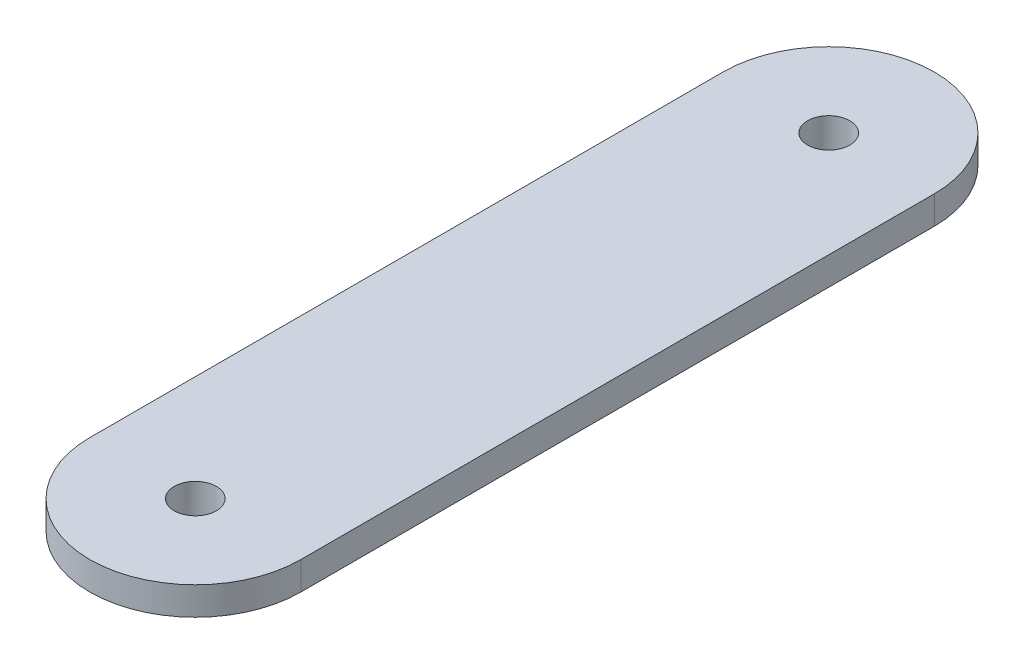
from build123d import *

# Parameters (mm, degrees)
BOSS_EXTRUDE1_DEPTH = 2
SKETCH2_R           = 1.5
CUT_EXTRUDE1_DEPTH  = 31.987900865
SKETCH3_R           = 2.25
SKETCH3_R_2         = 1.5
BOSS_EXTRUDE2_DEPTH = 0.5
FILLET1_R           = 5


with BuildPart() as part:
    # Sketch1 → Boss-Extrude1 (new body)
    with BuildSketch(Plane(origin=(0, 0, 0), x_dir=(1, 0, 0), z_dir=(0, 1, 0))):
        with BuildLine():
            Line((7.5, 22.5), (7.5, -22.5))
            ThreePointArc((7.5, -22.5), (0, -30), (-7.5, -22.5))
            Line((-7.5, -22.5), (-7.5, 22.5))
            ThreePointArc((-7.5, 22.5), (0, 30), (7.5, 22.5))
        make_face()
    extrude(amount=BOSS_EXTRUDE1_DEPTH)

    # Sketch2 → Cut-Extrude1 (cut, through all)
    with BuildSketch(Plane(origin=(0, 2, 0), x_dir=(1, 0, 0), z_dir=(0, 1, 0))):
        with Locations(Location((0, 22.5, 0), (0, 0, 270))):
            Circle(SKETCH2_R)
        with Locations(Location((0, -22.5, 0), (0, 0, 270))):
            Circle(SKETCH2_R)
    extrude(amount=-CUT_EXTRUDE1_DEPTH, mode=Mode.SUBTRACT)

    # Sketch3 → Boss-Extrude2 (add)
    # profile 1 of 2: a face of its own
    with BuildSketch(Plane.XZ):
        with Locations(Location((0, 22.5, 0), (0, 0, 90))):
            Circle(SKETCH3_R)
        with Locations(Location((0, 22.5, 0), (0, 0, 90))):
            Circle(SKETCH3_R_2, mode=Mode.SUBTRACT)
    # profile 2 of 2: a face of its own
    with BuildSketch(Plane.XZ):
        with Locations(Location((0, -22.5, 0), (0, 0, 90))):
            Circle(SKETCH3_R)
        with Locations(Location((0, -22.5, 0), (0, 0, 90))):
            Circle(SKETCH3_R_2, mode=Mode.SUBTRACT)
    extrude(amount=BOSS_EXTRUDE2_DEPTH)

    # Fillet1
    # the kernel refuses this fillet: 5 mm, written as the material it adds along each edge
    with BuildSketch(Plane(origin=(0, 0, 22.5), x_dir=(0, 0, 1), z_dir=(1, 0, 0))) as fillet1_piece_1:
        with BuildLine():
            CenterArc((4.429449472, 5), FILLET1_R, 244.158067237, 25.841932763)
            Line((2.25, 0.5), (2.206411011, 0.41))
            ThreePointArc((2.206411011, 0.41), (2.15, 0.25), (2.15, 0))
            Line((2.15, 0), (2.25, -0.1))
            Line((2.25, -0.1), (4.429449472, -0.1))
            Line((4.429449472, -0.1), (4.429449472, 0))
        make_face()
    revolve(axis=Axis((0, 0, 22.5), (0, -1, 0)))
    with BuildSketch(Plane(origin=(0, 0, -22.5), x_dir=(0, 0, 1), z_dir=(1, 0, 0))) as fillet1_piece_2:
        with BuildLine():
            CenterArc((4.429449472, 5), FILLET1_R, 244.158067237, 25.841932763)
            Line((2.25, 0.5), (2.206411011, 0.41))
            ThreePointArc((2.206411011, 0.41), (2.15, 0.25), (2.15, 0))
            Line((2.15, 0), (2.25, -0.1))
            Line((2.25, -0.1), (4.429449472, -0.1))
            Line((4.429449472, -0.1), (4.429449472, 0))
        make_face()
    revolve(axis=Axis((0, 0, -22.5), (0, -1, 0)))


solid = part.part
